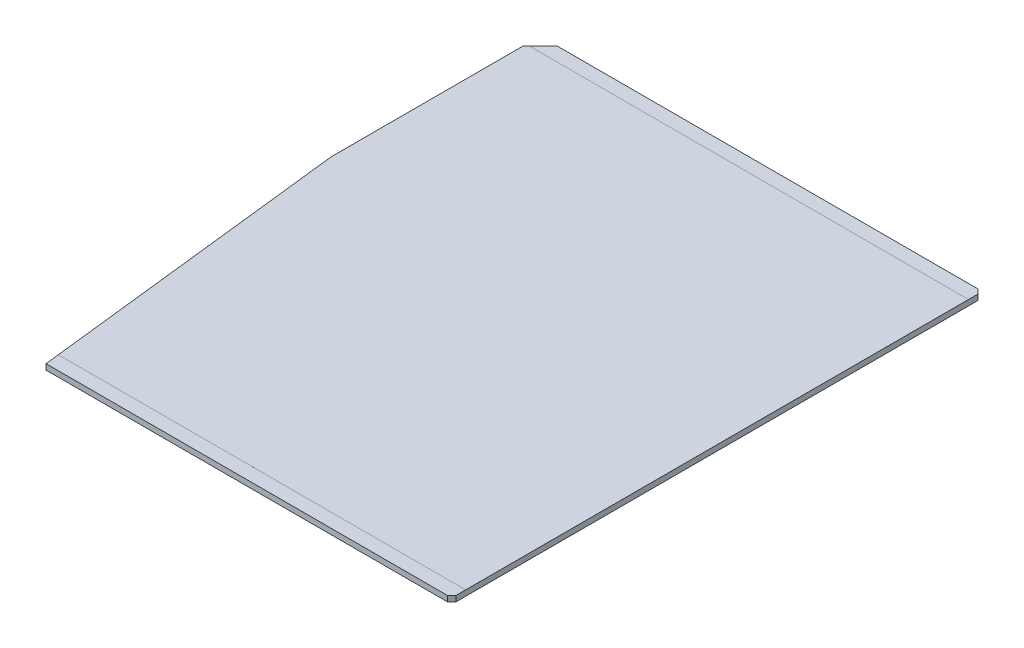
from build123d import *

# Parameters (mm, degrees)
SKETCH1_W               = 127
SKETCH1_H               = 152.4
BOSS_EXTRUDE1_DEPTH     = 1.6
CHAMFER1_SIZE           = 5
CHAMFER2_SIZE           = 1.27
SKETCH4_OUTSIDE_W       = 168.678
SKETCH4_OUTSIDE_H       = 194.078
SKETCH4_OUTSIDE_W_2     = 146.645454771
SKETCH4_OUTSIDE_H_2     = 144.4
CUT_EXTRUDE3_DEPTH      = 0.0001
CUT_EXTRUDE4_DEPTH      = 100.203074549
CUT_EXTRUDE4_DEPTH_BACK = 100.203074549


with BuildPart() as part:
    # Sketch1 → Boss-Extrude1 (new body)
    with BuildSketch(Plane(origin=(0, 0, 0), x_dir=(1, 0, 0), z_dir=(0, 1, 0))):
        Rectangle(SKETCH1_W, SKETCH1_H)
    extrude(amount=BOSS_EXTRUDE1_DEPTH)

    # Chamfer1
    chamfer1_edges = [part.edges().sort_by_distance(p)[0] for p in [
        (-63.5, 0.8, -76.2),
        (-63.5, 0.8, 76.2),
    ]]
    chamfer(chamfer1_edges, length=CHAMFER1_SIZE)

    # Chamfer2
    chamfer2_edges = [part.edges().sort_by_distance(p)[0] for p in [
        (63.5, 0.8, 76.2),
        (63.5, 0.8, -76.2),
    ]]
    chamfer(chamfer2_edges, length=CHAMFER2_SIZE)

    # Sketch4 outside → Cut-Extrude3 (cut)
    with BuildSketch(Plane(origin=(0, 1.6, 0), x_dir=(-1, 0, 0), z_dir=(0, 1, 0))):
        Rectangle(SKETCH4_OUTSIDE_W, SKETCH4_OUTSIDE_H)
        with Locations((0.842207065, 0)):
            Rectangle(SKETCH4_OUTSIDE_W_2, SKETCH4_OUTSIDE_H_2, mode=Mode.SUBTRACT)
    extrude(amount=-CUT_EXTRUDE3_DEPTH, mode=Mode.SUBTRACT)

    # Sketch5 → Cut-Extrude4 (cut, two sides: drawn at the far end of the back side and taken through both)
    with BuildSketch(Plane(origin=(0, 1.6, 0), x_dir=(1, 0, 0), z_dir=(0, 1, 0)).offset(-CUT_EXTRUDE4_DEPTH_BACK)):
        Polygon((-8.552407118, -467.338817365), (-53, -76.2), (-63.5, 16.2), (-107.947592882, 407.338817365), (-890.225227612, 318.4436316), (-790.830041847, -556.23400313), align=None)
    extrude(amount=CUT_EXTRUDE4_DEPTH + CUT_EXTRUDE4_DEPTH_BACK, mode=Mode.SUBTRACT)


solid = part.part
